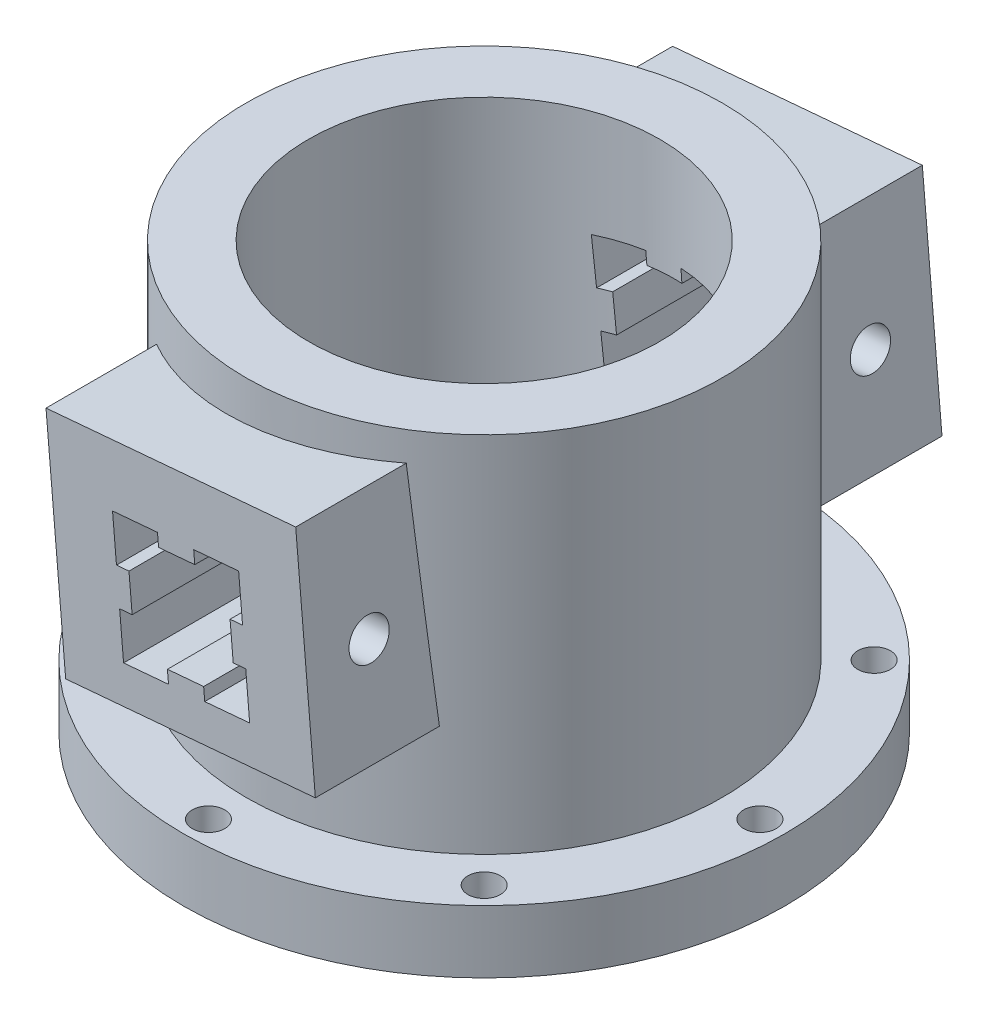
from build123d import *

# Parameters (mm, degrees)
ESQUISSE4_R                = 1.3
FIXINGHOLE_DEPTH           = 49.041648598
FIXINGHOLEREPETITION_COUNT = 8
RIGHTFIXING_DEPTH          = 10
TOPFIXINGHOLES_REACH       = 57.22
ESQUISSE7_R                = 1.6
HOLEFORFIXING_DEPTH        = 66.053823869


with BuildPart() as part:
    # Esquisse1 → Révolution1 (revolve)
    with BuildSketch(Plane.XY):
        Polygon((14, 0), (14, 34), (19, 34), (19, 5), (24, 5), (24, 0), align=None)
    revolve(axis=Axis((0, -1.825, 0), (0, 1, 0)))

    # Esquisse4 → FixingHole (cut, through all)
    with BuildSketch(Plane(origin=(0, 0, 0), x_dir=(-1, 0, 0), z_dir=(0, -1, 0))):
        with Locations((0, -22)):
            Circle(ESQUISSE4_R)
    fixinghole = extrude(amount=-FIXINGHOLE_DEPTH, mode=Mode.SUBTRACT)

    # FixingHoleRepetition: FixingHole ×8 about axis
    fixingholerepetition_axis = Axis((0, -1.825, 0), (0, 1, 0))
    for i in range(1, FIXINGHOLEREPETITION_COUNT):
        add(fixinghole.rotate(fixingholerepetition_axis, i * 360 / FIXINGHOLEREPETITION_COUNT), mode=Mode.SUBTRACT)

    # Esquisse5 → RightFixing (add)
    with BuildSketch(Plane.XY.offset(15)):
        Polygon((9.961946981, 31.674619421), (11.53075035, 13.743114855), (-8.393143611, 12), (-9.961946981, 29.931504566), align=None)
        Polygon((5.40803663, 26.357486686), (5.721797304, 22.771185773), (4.724085983, 22.683897343), (4.976837637, 19.794932719), (5.974548958, 19.882221149), (6.288309632, 16.295920235), (2.702008719, 15.982159562), (2.614720288, 16.979870883), (-0.274244336, 16.727119229), (-0.186955906, 15.729407908), (-3.773256819, 15.415647234), (-4.087017493, 19.001948147), (-3.089306172, 19.089236577), (-3.342057826, 21.978201201), (-4.339769147, 21.890912771), (-4.653529821, 25.477213684), (-1.067228908, 25.790974358), (-0.979940478, 24.793263037), (1.909024147, 25.046014691), (1.821735717, 26.043726012), align=None, mode=Mode.SUBTRACT)
    rightfixing = extrude(amount=RIGHTFIXING_DEPTH)

    # Esquisse7 → TopFixingHoles (cut, up to next)
    with BuildSketch(Plane(origin=(12.636394772, 1.10554129, 0), x_dir=(0, 0, -1), z_dir=(0.9961946980917462, 0.08715574274765185, 0)), mode=Mode.PRIVATE) as topfixingholes_sk1:
        with Locations((-20, 20.835847043)):
            Circle(ESQUISSE7_R)
    topfixingholes_tool1 = extrude(topfixingholes_sk1.sketch, amount=-TOPFIXINGHOLES_REACH, mode=Mode.PRIVATE) & part.part
    topfixingholes = topfixingholes_tool1.solids().sort_by_distance((10.820431, 21.862102, 20))[0]
    add(topfixingholes, mode=Mode.SUBTRACT)

    # FixingSymetry: RightFixing, TopFixingHoles across plane
    add(rightfixing.mirror(Plane.XY))
    add(topfixingholes.mirror(Plane.XY), mode=Mode.SUBTRACT)

    # Esquisse6 → HoleForFixing (cut, through all)
    with BuildSketch(Plane.XY.offset(25)):
        Polygon((5.40803663, 26.357486686), (5.721797304, 22.771185773), (4.724085983, 22.683897343), (4.976837637, 19.794932719), (5.974548958, 19.882221149), (6.288309632, 16.295920235), (2.702008719, 15.982159562), (2.614720288, 16.979870883), (-0.274244336, 16.727119229), (-0.186955906, 15.729407908), (-3.773256819, 15.415647234), (-4.087017493, 19.001948147), (-3.089306172, 19.089236577), (-3.342057826, 21.978201201), (-4.339769147, 21.890912771), (-4.653529821, 25.477213684), (-1.067228908, 25.790974358), (-0.979940478, 24.793263037), (1.909024147, 25.046014691), (1.821735717, 26.043726012), align=None)
    extrude(amount=-HOLEFORFIXING_DEPTH, mode=Mode.SUBTRACT)


solid = part.part
